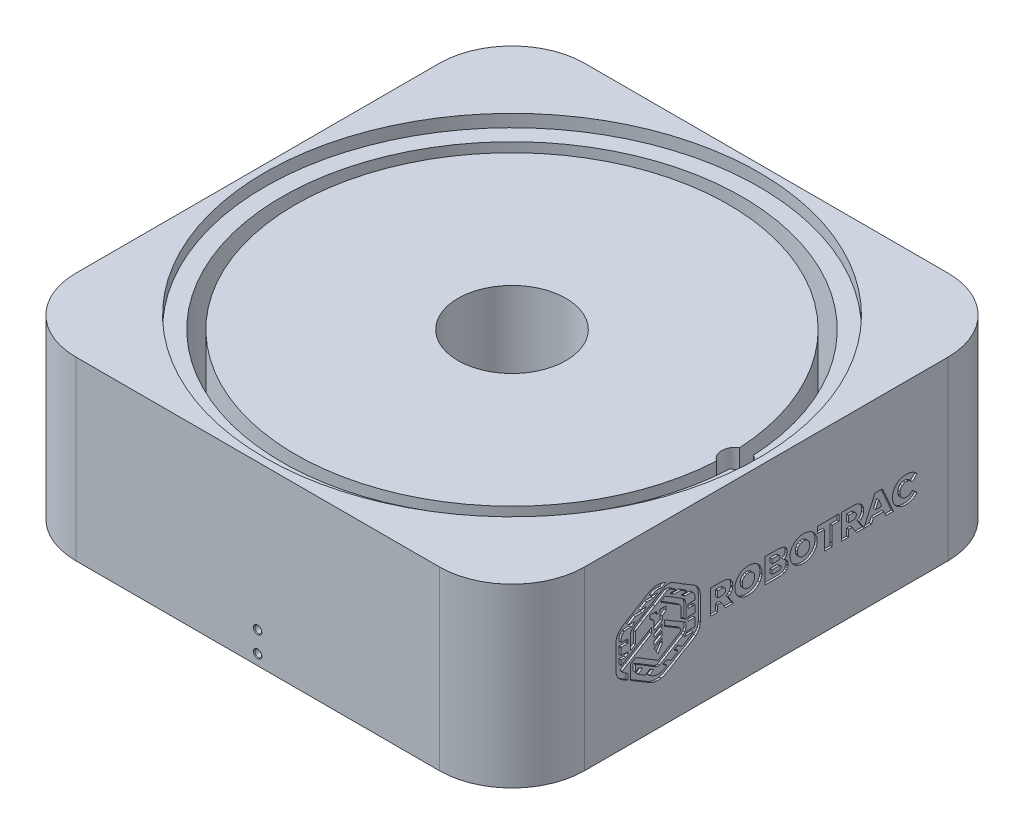
from build123d import *

# Parameters (mm, degrees)
SKETCH1_W                       = 245
SKETCH1_H                       = 245
BOSS_EXTRUDE1_DEPTH             = 85
SKETCH2_R                       = 110.75
SKETCH2_R_2                     = 104.25
CUT_EXTRUDE1_DEPTH              = 69.5
SKETCH3_R                       = 26
CUT_EXTRUDE2_DEPTH              = 193.970204954
SKETCH4_R                       = 6.5
CUT_EXTRUDE3_DEPTH              = 193.970204954
CIRPATTERN1_COUNT               = 4
SKETCH7_R                       = 119
CUT_EXTRUDE4_DEPTH              = 6
FILLET1_R                       = 35
CUT_EXTRUDE6_DEPTH              = 1
CIRPATTERN2_COUNT               = 2
SKETCH10_R                      = 3.15
CUT_EXTRUDE7_DEPTH              = 10
CUT_EXTRUDE8_DEPTH              = 10
M4X0_7_TAPPED_HOLE2_D           = 3.3
M4X0_7_TAPPED_HOLE2_DEPTH       = 10.1
M4X0_7_TAPPED_HOLE2_CSINK_D     = 4.05
M4X0_7_TAPPED_HOLE2_CSINK_ANGLE = 100
M4X0_7_TAPPED_HOLE2_TIP         = 0.991420021


with BuildPart() as part:
    # Sketch1 → Boss-Extrude1 (new body)
    with BuildSketch(Plane(origin=(0, 0, 0), x_dir=(1, 0, 0), z_dir=(0, 1, 0))):
        Rectangle(SKETCH1_W, SKETCH1_H)
    extrude(amount=BOSS_EXTRUDE1_DEPTH)

    # Sketch2 → Cut-Extrude1 (cut)
    with BuildSketch(Plane(origin=(0, 85, 0), x_dir=(1, 0, 0), z_dir=(0, 1, 0))):
        with Locations(Location((0, 0, 0), (0, 0, 270))):
            Circle(SKETCH2_R)
        with Locations(Location((0, 0, 0), (0, 0, 270))):
            Circle(SKETCH2_R_2, mode=Mode.SUBTRACT)
    extrude(amount=-CUT_EXTRUDE1_DEPTH, mode=Mode.SUBTRACT)

    # Sketch3 → Cut-Extrude2 (cut, through all)
    with BuildSketch(Plane(origin=(0, 85, 0), x_dir=(1, 0, 0), z_dir=(0, 1, 0))):
        with Locations(Location((0, 0, 0), (0, 0, 270))):
            Circle(SKETCH3_R)
    extrude(amount=-CUT_EXTRUDE2_DEPTH, mode=Mode.SUBTRACT)

    # Sketch4 → Cut-Extrude3 (cut, through all)
    with BuildSketch(Plane(origin=(0, 85, 0), x_dir=(1, 0, 0), z_dir=(0, 1, 0))):
        with Locations(Location((107.5, 0, 0), (0, 0, 270))):
            Circle(SKETCH4_R)
    extrude(amount=-CUT_EXTRUDE3_DEPTH, mode=Mode.SUBTRACT)

    # Sketch6 → M4x0.7 Tapped Hole1 (revolve, cut)
    with BuildSketch(Plane(origin=(-40, 0, 0), x_dir=(0, 0, -1), z_dir=(1, 0, 0))):
        Polygon((0, 0), (0, 12.991420021), (1.65, 12), (1.65, 0.314662362), (2.025, 0), align=None)
    m4x0_7_tapped_hole1 = revolve(axis=Axis((-40, -6.35, 0), (0, 1, 0)), mode=Mode.SUBTRACT)

    # CirPattern1: M4x0.7 Tapped Hole1 ×4 about axis
    cirpattern1_axis = Axis((0, 0, 0), (0, 1, 0))
    for i in range(1, CIRPATTERN1_COUNT):
        add(m4x0_7_tapped_hole1.rotate(cirpattern1_axis, i * 360 / CIRPATTERN1_COUNT), mode=Mode.SUBTRACT)

    # Sketch7 → Cut-Extrude4 (cut)
    with BuildSketch(Plane(origin=(0, 85, 0), x_dir=(1, 0, 0), z_dir=(0, 1, 0))):
        with Locations(Location((0, 0, 0), (0, 0, 270))):
            Circle(SKETCH7_R)
    extrude(amount=-CUT_EXTRUDE4_DEPTH, mode=Mode.SUBTRACT)

    # Fillet1
    fillet1_edges = [part.edges().sort_by_distance(p)[0] for p in [
        (122.5, 42.5, 122.5),
        (-122.5, 42.5, 122.5),
        (-122.5, 42.5, -122.5),
        (122.5, 42.5, -122.5),
    ]]
    fillet(fillet1_edges, radius=FILLET1_R)

    # Sketch9 → Cut-Extrude6 (cut)
    # profile 1 of 14: a face of its own
    with BuildSketch(Plane(origin=(122.5, 0, 0), x_dir=(0, 0, -1), z_dir=(1, 0, 0))):
        Polygon((-50.186409307, 36.587784241), (-51.106557377, 36.127710206), (-51.489952406, 35.820994183), (-53.483606557, 34.747488102), (-54.020359598, 34.364093072), (-53.943680592, 34.057377049), (-52.180063458, 31.066895822), (-50.186409307, 34.440772078), (-50.109730301, 34.670809096), (-50.186409307, 34.824167107), align=None)
    # profile 2 of 14: a face of its own
    with BuildSketch(Plane(origin=(122.5, 0, 0), x_dir=(0, 0, -1), z_dir=(1, 0, 0))):
        Polygon((-50.186409307, 39.654944474), (-50.493125331, 39.578265468), (-54.097038604, 37.431253305), (-54.17371761, 37.047858276), (-54.097038604, 35.51427816), (-50.186409307, 37.737969328), align=None)
    # profile 3 of 14: a face of its own
    with BuildSketch(Plane(origin=(122.5, 0, 0), x_dir=(0, 0, -1), z_dir=(1, 0, 0))):
        Polygon((-50.186409307, 42.722104707), (-54.097038604, 40.498413538), (-54.17371761, 40.115018509), (-54.097038604, 38.658117398), (-53.25356954, 39.041512427), (-52.486779482, 39.578265468), (-51.950026441, 39.808302485), (-50.186409307, 40.881808567), align=None)
    # profile 4 of 14: a face of its own
    with BuildSketch(Plane(origin=(122.5, 0, 0), x_dir=(0, 0, -1), z_dir=(1, 0, 0))):
        Polygon((-0.651771549, 45.865943945), (-0.728450555, 45.712585933), (-0.651771549, 45.635906928), (-0.651771549, 43.412215759), (-0.728450555, 43.335536753), (-0.651771549, 42.952141724), (-0.651771549, 39.501586462), (-0.728450555, 39.424907456), (-0.651771549, 34.057377049), (6.939450026, 34.057377049), (8.626388154, 34.440772078), (9.699894236, 35.130883131), (10.159968271, 35.744315177), (10.390005288, 36.357747224), (10.390005288, 36.741142253), (10.466684294, 36.817821259), (10.390005288, 38.044685352), (9.929931253, 39.041512427), (9.393178213, 39.578265468), (8.473030143, 40.115018509), (9.393178213, 40.805129561), (9.776573242, 41.341882602), (10.006610259, 42.031993654), (10.006610259, 43.412215759), (9.853252247, 43.872289794), (9.469857218, 44.48572184), (8.779746166, 45.099153887), (8.16631412, 45.40586991), (6.786092015, 45.789264939), (6.249338974, 45.789264939), (6.172659968, 45.865943945), align=None)
        Polygon((2.722104707, 38.581438392), (2.798783712, 38.658117398), (6.095980962, 38.658117398), (6.402696986, 38.581438392), (6.862771021, 38.198043363), (7.016129032, 37.89132734), (6.939450026, 37.201216288), (6.556054997, 36.817821259), (6.172659968, 36.664463247), (2.798783712, 36.664463247), (2.722104707, 36.741142253), align=None, mode=Mode.SUBTRACT)
        Polygon((2.722104707, 43.105499736), (2.798783712, 43.182178741), (5.635906928, 43.182178741), (6.172659968, 42.952141724), (6.479375992, 42.568746695), (6.556054997, 42.338709677), (6.479375992, 41.648598625), (6.172659968, 41.265203596), (5.789264939, 41.111845584), (2.798783712, 41.111845584), (2.722104707, 41.18852459), align=None, mode=Mode.SUBTRACT)
    # profile 5 of 14: a face of its own
    with BuildSketch(Plane(origin=(122.5, 0, 0), x_dir=(0, 0, -1), z_dir=(1, 0, 0))):
        Polygon((-26.875991539, 45.865943945), (-26.952670545, 45.789264939), (-26.952670545, 34.057377049), (-23.425436277, 34.057377049), (-23.502115283, 36.894500264), (-23.348757271, 37.277895293), (-21.815177155, 37.277895293), (-19.668164992, 34.057377049), (-15.910893707, 34.057377049), (-16.064251719, 34.440772078), (-18.364621893, 37.814648334), (-18.287942887, 37.968006346), (-17.751189847, 38.274722369), (-16.907720783, 39.118191433), (-16.447646748, 39.961660497), (-16.21760973, 40.728450555), (-16.21760973, 41.18852459), (-16.140930724, 41.265203596), (-16.21760973, 42.415388683), (-16.601004759, 43.56557377), (-17.061078794, 44.255684823), (-17.521152829, 44.715758858), (-18.211263882, 45.175832893), (-18.824695928, 45.482548916), (-19.974881015, 45.789264939), (-20.588313062, 45.789264939), (-20.664992068, 45.865943945), align=None)
        Polygon((-23.502115283, 42.875462718), (-23.348757271, 43.02882073), (-21.125066103, 43.02882073), (-20.358276044, 42.798783712), (-19.89820201, 42.338709677), (-19.668164992, 41.725277631), (-19.668164992, 41.265203596), (-19.89820201, 40.651771549), (-20.358276044, 40.191697515), (-20.971708091, 39.961660497), (-23.348757271, 39.961660497), (-23.425436277, 40.038339503), (-23.425436277, 40.805129561), (-23.502115283, 40.881808567), align=None, mode=Mode.SUBTRACT)
    # profile 6 of 14: a face of its own
    with BuildSketch(Plane(origin=(122.5, 0, 0), x_dir=(0, 0, -1), z_dir=(1, 0, 0))):
        Polygon((61.151507139, 33.827340032), (61.151507139, 33.980698043), (60.078001058, 36.281068218), (59.771285034, 37.201216288), (58.92781597, 38.888154416), (58.774457959, 39.424907456), (58.39106293, 40.115018509), (58.161025912, 40.805129561), (57.700951877, 41.648598625), (57.317556848, 42.722104707), (56.704124802, 43.872289794), (55.860655738, 45.865943945), (54.633791645, 45.865943945), (54.557112639, 45.942622951), (54.480433633, 45.865943945), (54.250396616, 45.942622951), (54.097038604, 45.865943945), (52.256742464, 45.865943945), (51.336594395, 43.642252776), (49.496298255, 39.654944474), (49.03622422, 38.428080381), (48.269434162, 36.894500264), (47.349286092, 34.59413009), (47.042570069, 34.057377049), (44.665520888, 37.661290323), (44.742199894, 37.814648334), (45.508989952, 38.274722369), (46.122421999, 38.964833421), (46.582496034, 39.808302485), (46.812533051, 40.575092544), (46.812533051, 42.262030672), (46.582496034, 43.105499736), (45.969063987, 44.179005817), (45.432310947, 44.715758858), (44.742199894, 45.175832893), (44.128767848, 45.482548916), (43.055261766, 45.789264939), (42.671866737, 45.789264939), (42.595187731, 45.865943945), (36.077472237, 45.865943945), (36.077472237, 33.904019038), (36.154151243, 33.827340032), (39.528027499, 33.827340032), (39.604706504, 33.904019038), (39.604706504, 37.047858276), (39.68138551, 37.124537282), (41.214965627, 37.124537282), (43.438656795, 33.827340032), (50.569804336, 33.827340032), (51.566631412, 36.0510312), (56.55076679, 36.0510312), (57.47091486, 33.827340032), align=None)
        Polygon((54.020359598, 42.185351666), (54.17371761, 42.10867266), (55.400581703, 39.041512427), (55.323902697, 38.734796404), (52.716816499, 38.734796404), (52.640137493, 38.81147541), align=None, mode=Mode.SUBTRACT)
        Polygon((39.604706504, 42.875462718), (39.68138551, 42.952141724), (41.828397673, 42.952141724), (42.595187731, 42.722104707), (43.208619778, 42.10867266), (43.36197779, 41.265203596), (43.131940772, 40.498413538), (42.748545743, 40.115018509), (42.288471708, 39.884981491), (41.905076679, 39.808302485), (39.68138551, 39.808302485), (39.604706504, 39.884981491), align=None, mode=Mode.SUBTRACT)
    # profile 7 of 14: a face of its own
    with BuildSketch(Plane(origin=(122.5, 0, 0), x_dir=(0, 0, -1), z_dir=(1, 0, 0))):
        Polygon((35.003966155, 45.865943945), (34.467213115, 45.865943945), (34.390534109, 45.942622951), (33.853781068, 45.942622951), (33.777102062, 45.865943945), (24.728979376, 45.865943945), (24.728979376, 42.798783712), (28.026176626, 42.798783712), (28.102855632, 42.722104707), (28.102855632, 33.904019038), (28.179534638, 33.827340032), (31.553410894, 33.827340032), (31.553410894, 35.437599154), (31.6300899, 35.51427816), (31.6300899, 42.722104707), (31.706768905, 42.798783712), (35.003966155, 42.798783712), align=None)
    # profile 8 of 14: a face of its own
    with BuildSketch(Plane(origin=(122.5, 0, 0), x_dir=(0, 0, -1), z_dir=(1, 0, 0))):
        Polygon((16.677683765, 46.019301957), (15.450819672, 45.712585933), (14.223955579, 45.099153887), (13.380486515, 44.48572184), (12.383659439, 43.335536753), (11.770227393, 42.185351666), (11.46351137, 41.035166579), (11.386832364, 39.424907456), (11.46351137, 39.348228451), (11.540190375, 38.428080381), (11.846906399, 37.507932311), (12.613696457, 36.204389212), (13.150449498, 35.590957166), (14.377313591, 34.670809096), (15.834214701, 34.057377049), (16.984399788, 33.827340032), (18.824695928, 33.827340032), (19.974881015, 34.057377049), (20.664992068, 34.287414067), (22.121893178, 35.130883131), (22.888683236, 35.820994183), (23.578794289, 36.741142253), (24.192226335, 38.121364357), (24.422263353, 39.348228451), (24.422263353, 40.651771549), (24.192226335, 41.801956637), (23.655473295, 43.02882073), (23.19539926, 43.718931782), (22.27525119, 44.639079852), (21.508461132, 45.175832893), (20.588313062, 45.635906928), (19.208090957, 46.019301957), (18.671337916, 46.019301957), (18.594658911, 46.095980962), align=None)
        Polygon((17.061078794, 43.02882073), (18.287942887, 43.105499736), (18.364621893, 43.02882073), (18.748016922, 43.02882073), (19.438127975, 42.722104707), (20.358276044, 41.878635643), (20.818350079, 40.881808567), (20.895029085, 39.424907456), (20.588313062, 38.351401375), (20.358276044, 37.968006346), (19.821523004, 37.431253305), (18.824695928, 36.894500264), (17.291115812, 36.817821259), (16.447646748, 37.124537282), (15.68085669, 37.737969328), (15.29746166, 38.274722369), (14.990745637, 39.041512427), (14.914066631, 40.26837652), (15.220782655, 41.495240613), (15.527498678, 41.955314648), (16.21760973, 42.645425701), align=None, mode=Mode.SUBTRACT)
    # profile 9 of 14: a face of its own
    with BuildSketch(Plane(origin=(122.5, 0, 0), x_dir=(0, 0, -1), z_dir=(1, 0, 0))):
        Polygon((-11.156795346, 45.712585933), (-12.153622422, 45.252511898), (-12.92041248, 44.715758858), (-14.070597567, 43.488894765), (-14.837387626, 42.031993654), (-15.144103649, 40.575092544), (-15.144103649, 39.194870439), (-14.914066631, 38.121364357), (-14.453992597, 36.97117927), (-13.763881544, 35.974352195), (-13.073770492, 35.284241142), (-11.923585405, 34.517451084), (-10.773400317, 34.057377049), (-9.546536224, 33.827340032), (-7.78291909, 33.827340032), (-6.32601798, 34.134056055), (-5.40586991, 34.517451084), (-4.255684823, 35.284241142), (-3.182178741, 36.43442623), (-2.338709677, 38.198043363), (-2.185351666, 38.81147541), (-2.185351666, 39.424907456), (-2.10867266, 39.501586462), (-2.185351666, 41.035166579), (-2.568746695, 42.338709677), (-2.875462718, 42.952141724), (-3.642252776, 44.025647805), (-4.179005817, 44.562400846), (-5.329190904, 45.329190904), (-6.019301957, 45.635906928), (-7.016129032, 45.942622951), (-7.936277102, 46.019301957), (-8.012956108, 46.095980962), (-9.316499207, 46.095980962), align=None)
        Polygon((-9.546536224, 43.02882073), (-8.242993125, 43.105499736), (-7.092808038, 42.722104707), (-6.249338974, 41.955314648), (-5.789264939, 41.111845584), (-5.635906928, 40.421734532), (-5.635906928, 39.501586462), (-6.019301957, 38.274722369), (-6.632734003, 37.507932311), (-7.169487044, 37.124537282), (-7.706240085, 36.894500264), (-9.239820201, 36.817821259), (-10.236647277, 37.201216288), (-11.080116341, 37.968006346), (-11.540190375, 38.964833421), (-11.616869381, 40.651771549), (-11.310153358, 41.571919619), (-11.080116341, 41.955314648), (-10.5433633, 42.492067689), align=None, mode=Mode.SUBTRACT)
    # profile 10 of 14: a face of its own
    with BuildSketch(Plane(origin=(122.5, 0, 0), x_dir=(0, 0, -1), z_dir=(1, 0, 0))):
        Polygon((66.058963511, 46.095980962), (64.678741407, 45.712585933), (63.835272343, 45.329190904), (62.838445267, 44.639079852), (62.225013221, 44.025647805), (61.534902168, 43.105499736), (60.921470122, 41.648598625), (60.76811211, 40.881808567), (60.76811211, 40.26837652), (60.691433104, 40.191697515), (60.76811211, 38.888154416), (60.998149127, 37.814648334), (61.458223162, 36.741142253), (62.225013221, 35.667636171), (63.375198308, 34.670809096), (64.372025383, 34.134056055), (65.215494447, 33.827340032), (66.44235854, 33.67398202), (66.519037546, 33.597303014), (68.129296668, 33.597303014), (69.356160762, 33.827340032), (70.199629825, 34.134056055), (71.273135907, 34.747488102), (72.423320994, 35.820994183), (72.5, 36.0510312), (70.352987837, 38.044685352), (69.126123744, 37.047858276), (68.359333686, 36.741142253), (66.902432575, 36.664463247), (66.058963511, 36.894500264), (65.445531465, 37.277895293), (64.755420412, 37.968006346), (64.295346378, 39.118191433), (64.295346378, 40.651771549), (64.525383395, 41.341882602), (64.908778424, 41.955314648), (65.445531465, 42.492067689), (66.289000529, 42.952141724), (66.902432575, 43.105499736), (68.205975674, 43.02882073), (69.279481756, 42.568746695), (70.352987837, 41.648598625), (72.5, 43.718931782), (72.5, 43.872289794), (71.809888948, 44.639079852), (71.196456901, 45.099153887), (70.199629825, 45.635906928), (68.589370703, 46.095980962), (67.899259651, 46.095980962), (67.822580645, 46.172659968), align=None)
    # profile 11 of 14: a face of its own
    with BuildSketch(Plane(origin=(122.5, 0, 0), x_dir=(0, 0, -1), z_dir=(1, 0, 0))):
        Polygon((-54.17371761, 41.725277631), (-54.020359598, 41.648598625), (-51.259915389, 43.335536753), (-50.569804336, 43.642252776), (-50.186409307, 43.9489688), (-50.109730301, 44.255684823), (-50.109730301, 45.482548916), (-50.186409307, 45.559227922), (-50.109730301, 45.942622951), (-48.269434162, 47.322845056), (-48.269434162, 49.163141195), (-51.259915389, 49.163141195), (-51.336594395, 49.086462189), (-51.336594395, 48.012956108), (-51.4132734, 47.936277102), (-52.870174511, 47.936277102), (-53.023532522, 48.319672131), (-53.023532522, 49.163141195), (-56.014013749, 49.163141195), (-56.014013749, 47.322845056), (-54.327075621, 46.095980962), (-54.097038604, 45.712585933), (-54.097038604, 43.795610788), (-54.17371761, 43.718931782), (-54.17371761, 41.878635643), (-54.097038604, 41.801956637), align=None)
    # profile 12 of 14: a face of its own
    with BuildSketch(Plane(origin=(122.5, 0, 0), x_dir=(0, 0, -1), z_dir=(1, 0, 0))):
        Polygon((-50.87652036, 52.230301428), (-50.953199365, 52.076943416), (-50.799841354, 51.923585405), (-42.288471708, 46.632734003), (-41.445002644, 45.942622951), (-41.214965627, 45.40586991), (-41.214965627, 40.345055526), (-38.837916446, 38.964833421), (-38.761237441, 39.271549445), (-38.761237441, 45.559227922), (-38.991274458, 46.632734003), (-39.451348493, 47.476203067), (-40.141459545, 48.16631412), (-40.524854574, 48.319672131), (-41.138286621, 48.779746166), (-42.901903755, 49.776573242), (-44.128767848, 50.620042306), (-48.806187203, 53.457165521), align=None)
    # profile 13 of 14: a face of its own
    with BuildSketch(Plane(origin=(122.5, 0, 0), x_dir=(0, 0, -1), z_dir=(1, 0, 0))):
        Polygon((-46.505817028, 57.827868852), (-47.809360127, 57.827868852), (-48.959545214, 57.444473823), (-55.63061872, 53.303807509), (-56.014013749, 53.150449498), (-56.627445796, 52.690375463), (-58.161025912, 51.846906399), (-59.004494976, 51.233474352), (-62.148334215, 49.393178213), (-63.14516129, 48.70306716), (-63.911951348, 48.319672131), (-64.755420412, 47.552882073), (-65.215494447, 46.786092015), (-65.445531465, 46.019301957), (-65.445531465, 45.635906928), (-65.522210471, 45.559227922), (-65.522210471, 39.041512427), (-65.445531465, 38.964833421), (-63.068482285, 40.421734532), (-63.068482285, 45.559227922), (-62.838445267, 46.019301957), (-62.531729244, 46.32601798), (-59.771285034, 48.089635114), (-59.387890005, 48.242993125), (-57.624272871, 49.393178213), (-54.480433633, 51.233474352), (-53.867001586, 51.693548387), (-53.483606557, 51.846906399), (-49.189582232, 54.530671602), (-47.809360127, 55.29746166), (-46.582496034, 55.29746166), (-46.352459016, 55.220782655), (-43.592014807, 53.533844527), (-43.668693813, 53.457165521), (-46.505817028, 53.457165521), (-46.429138022, 53.303807509), (-44.512162877, 52.076943416), (-41.138286621, 52.076943416), (-38.147805394, 50.159968271), (-38.2244844, 50.083289265), (-41.061607615, 50.083289265), (-40.984928609, 49.929931253), (-39.14463247, 48.70306716), (-36.000793231, 48.70306716), (-35.310682179, 48.242993125), (-35.003966155, 47.859598096), (-34.543892121, 46.939450026), (-34.313855103, 45.865943945), (-34.313855103, 44.715758858), (-34.390534109, 44.639079852), (-37.381015336, 44.639079852), (-37.687731359, 44.562400846), (-37.687731359, 42.798783712), (-37.457694342, 42.722104707), (-35.387361185, 42.722104707), (-35.157324167, 42.798783712), (-35.080645161, 42.722104707), (-34.390534109, 42.722104707), (-34.313855103, 42.645425701), (-34.313855103, 39.348228451), (-34.390534109, 39.271549445), (-37.150978318, 39.271549445), (-37.227657324, 39.194870439), (-37.687731359, 39.194870439), (-37.687731359, 37.431253305), (-34.390534109, 37.431253305), (-34.313855103, 37.354574299), (-34.313855103, 33.980698043), (-34.390534109, 33.750661026), (-34.543892121, 33.597303014), (-38.147805394, 33.597303014), (-38.761237441, 32.600475939), (-39.604706504, 31.83368588), (-35.310682179, 31.83368588), (-35.234003173, 31.757006875), (-36.000793231, 31.066895822), (-40.371496563, 28.459809625), (-40.754891592, 28.53648863), (-41.138286621, 28.843204654), (-41.675039662, 29.073241671), (-42.288471708, 29.533315706), (-42.901903755, 29.840031729), (-44.052088842, 29.149920677), (-44.512162877, 28.766525648), (-42.365150714, 27.386303543), (-45.969063987, 25.23929138), (-48.11607615, 26.542834479), (-48.499471179, 26.466155473), (-49.95637229, 25.546007403), (-48.959545214, 24.855896351), (-48.346113168, 24.549180328), (-47.886039133, 24.165785299), (-48.269434162, 23.859069276), (-50.109730301, 22.8622422), (-50.799841354, 22.632205182), (-51.719989424, 22.555526177), (-51.796668429, 22.478847171), (-52.946853517, 22.555526177), (-54.787149656, 23.168958223), (-55.323902697, 23.552353252), (-56.244050767, 24.012427287), (-56.397408778, 24.165785299), (-56.320729773, 24.31914331), (-54.940507668, 25.085933369), (-54.327075621, 25.546007403), (-56.090692755, 26.619513485), (-58.237704918, 25.315970386), (-58.467741935, 25.315970386), (-61.68826018, 27.232945531), (-61.841618191, 27.386303543), (-61.68826018, 27.539661555), (-59.924643046, 28.613167636), (-59.771285034, 28.843204654), (-61.381544157, 29.840031729), (-63.068482285, 28.766525648), (-63.14516129, 28.843204654), (-63.14516129, 32.063722898), (-62.991803279, 32.140401904), (-62.301692226, 31.680327869), (-61.534902168, 31.29693284), (-53.406927552, 26.312797462), (-52.716816499, 26.006081438), (-51.566631412, 26.006081438), (-50.87652036, 26.312797462), (-50.493125331, 26.619513485), (-48.192755156, 27.923056584), (-46.812533051, 28.843204654), (-43.745372819, 30.606821787), (-40.064780539, 32.907191962), (-39.297990481, 33.750661026), (-38.837916446, 34.824167107), (-38.761237441, 35.207562136), (-38.761237441, 37.431253305), (-38.991274458, 37.661290323), (-42.748545743, 39.961660497), (-43.131940772, 40.115018509), (-44.512162877, 41.035166579), (-45.048915918, 41.265203596), (-48.652829191, 43.488894765), (-49.03622422, 43.642252776), (-49.03622422, 40.958487573), (-41.368323638, 36.357747224), (-41.214965627, 36.127710206), (-41.214965627, 35.51427816), (-41.445002644, 34.977525119), (-41.675039662, 34.747488102), (-52.103384453, 28.383130619), (-52.256742464, 28.383130619), (-55.400581703, 30.37678477), (-57.47091486, 31.526969857), (-58.697778953, 32.370438921), (-62.991803279, 34.900846113), (-65.368852459, 33.443945003), (-65.368852459, 26.542834479), (-56.244050767, 21.098625066), (-54.71047065, 20.408514014), (-53.483606557, 20.10179799), (-53.023532522, 20.10179799), (-52.946853517, 20.025118985), (-50.723162348, 20.10179799), (-48.806187203, 20.715230037), (-43.592014807, 23.705711264), (-40.984928609, 25.315970386), (-40.064780539, 25.776044421), (-39.14463247, 26.389476467), (-38.2244844, 26.849550502), (-33.930460074, 29.533315706), (-32.856953993, 30.760179799), (-32.320200952, 31.757006875), (-31.936805923, 32.983870968), (-31.860126917, 34.057377049), (-31.783447911, 34.134056055), (-31.783447911, 45.789264939), (-31.860126917, 45.865943945), (-31.860126917, 46.479375992), (-32.013484929, 47.24616605), (-32.243521946, 47.936277102), (-32.856953993, 49.163141195), (-34.00713908, 50.466684294), (-35.387361185, 51.386832364), (-35.924114225, 51.616869381), (-36.537546272, 52.076943416), (-40.908249603, 54.684029614), (-41.905076679, 55.374140666), (-42.671866737, 55.757535695), (-44.512162877, 56.984399788), (-45.355631941, 57.444473823), align=None)
    # profile 14 of 14: a face of its own
    with BuildSketch(Plane(origin=(122.5, 0, 0), x_dir=(0, 0, -1), z_dir=(1, 0, 0))):
        Polygon((-49.95637229, 59.591485986), (-51.336594395, 59.89820201), (-52.256742464, 59.89820201), (-52.33342147, 59.974881015), (-53.790322581, 59.89820201), (-54.863828662, 59.668164992), (-55.707297726, 59.361448969), (-58.544420941, 57.751189847), (-59.387890005, 57.1377578), (-62.301692226, 55.450819672), (-64.908778424, 53.763881544), (-65.675568482, 53.380486515), (-67.285827604, 52.306980434), (-69.892913802, 50.773400317), (-71.273135907, 49.393178213), (-72.039925965, 48.012956108), (-72.5, 46.32601798), (-72.5, 33.67398202), (-72.193283977, 32.293759915), (-71.57985193, 30.990216816), (-70.966419884, 30.146747753), (-70.046271814, 29.303278689), (-67.975938657, 27.99973559), (-66.519037546, 27.232945531), (-66.519037546, 30.070068747), (-68.742728715, 31.450290851), (-69.279481756, 32.063722898), (-69.432839767, 32.523796933), (-66.902432575, 34.057377049), (-66.365679535, 34.287414067), (-59.464569011, 38.504759387), (-57.777630883, 39.424907456), (-55.247223691, 41.035166579), (-55.247223691, 43.642252776), (-55.400581703, 43.642252776), (-69.892913802, 34.900846113), (-70.046271814, 35.130883131), (-70.046271814, 37.277895293), (-69.892913802, 37.431253305), (-67.745901639, 37.431253305), (-66.595716552, 38.198043363), (-66.672395558, 39.194870439), (-67.055790587, 39.271549445), (-69.969592808, 39.271549445), (-70.046271814, 39.348228451), (-70.046271814, 42.338709677), (-69.969592808, 42.415388683), (-70.046271814, 42.645425701), (-69.969592808, 42.722104707), (-66.749074564, 42.722104707), (-66.672395558, 42.798783712), (-66.672395558, 43.56557377), (-66.595716552, 43.642252776), (-66.595716552, 44.332363829), (-66.749074564, 44.639079852), (-69.892913802, 44.639079852), (-69.969592808, 44.715758858), (-69.969592808, 45.099153887), (-70.046271814, 45.175832893), (-69.969592808, 46.249338974), (-69.662876785, 47.24616605), (-69.279481756, 47.936277102), (-68.666049709, 48.549709149), (-68.359333686, 48.70306716), (-65.138815442, 48.70306716), (-63.298519302, 49.929931253), (-63.221840296, 50.083289265), (-66.058963511, 50.083289265), (-66.135642517, 50.159968271), (-65.675568482, 50.5433633), (-63.14516129, 52.076943416), (-59.771285034, 52.076943416), (-57.700951877, 53.380486515), (-57.700951877, 53.457165521), (-60.614754098, 53.457165521), (-60.691433104, 53.533844527), (-59.541248017, 54.300634585), (-57.700951877, 55.374140666), (-54.403754627, 55.374140666), (-52.410100476, 56.601004759), (-52.486779482, 56.677683765), (-55.247223691, 56.677683765), (-55.323902697, 56.754362771), (-55.09386568, 56.984399788), (-53.636964569, 57.751189847), (-53.023532522, 57.904547858), (-51.566631412, 57.981226864), (-51.489952406, 57.904547858), (-50.416446325, 57.827868852), (-49.112903226, 58.671337916), (-48.729508197, 58.824695928), (-48.576150185, 58.97805394), align=None)
    cut_extrude6 = extrude(amount=-CUT_EXTRUDE6_DEPTH, mode=Mode.SUBTRACT)

    # CirPattern2: Cut-Extrude6 ×2 about axis
    cirpattern2_axis = Axis((0, 0, 0), (0, 1, 0))
    for i in range(1, CIRPATTERN2_COUNT):
        add(cut_extrude6.rotate(cirpattern2_axis, i * 360 / CIRPATTERN2_COUNT), mode=Mode.SUBTRACT)

    # Sketch10 → Cut-Extrude7 (cut)
    with BuildSketch(Plane.XZ):
        with Locations(Location((-95, 95, 0), (0, 0, 270))):
            Circle(SKETCH10_R)
    extrude(amount=-CUT_EXTRUDE7_DEPTH, mode=Mode.SUBTRACT)

    # Sketch11 → Cut-Extrude8 (cut)
    with BuildSketch(Plane.XZ):
        with BuildLine():
            ThreePointArc((92.984745674, -88.529972952), (90.757359313, -87.607359313), (88.529972952, -88.529972952))
            Line((88.529972952, -88.529972952), (101.470027048, -101.470027048))
            ThreePointArc((101.470027048, -101.470027048), (102.392640687, -99.242640687), (101.470027048, -97.015254326))
            Line((101.470027048, -97.015254326), (92.984745674, -88.529972952))
        make_face()
        with BuildLine():
            Line((101.470027048, -101.470027048), (88.529972952, -88.529972952))
            ThreePointArc((88.529972952, -88.529972952), (87.607359313, -90.757359313), (88.529972952, -92.984745674))
            Line((88.529972952, -92.984745674), (97.015254326, -101.470027048))
            ThreePointArc((97.015254326, -101.470027048), (99.242640687, -102.392640687), (101.470027048, -101.470027048))
        make_face()
    extrude(amount=-CUT_EXTRUDE8_DEPTH, mode=Mode.SUBTRACT)

    # M4x0.7 Tapped Hole2
    with Locations(Plane.XY.offset(122.5)):
        with Locations((0, 5), (0, 15)):
            CounterSinkHole(M4X0_7_TAPPED_HOLE2_D / 2, M4X0_7_TAPPED_HOLE2_CSINK_D / 2, depth=M4X0_7_TAPPED_HOLE2_DEPTH, counter_sink_angle=M4X0_7_TAPPED_HOLE2_CSINK_ANGLE)
            with Locations((0, 0, -(M4X0_7_TAPPED_HOLE2_DEPTH + M4X0_7_TAPPED_HOLE2_TIP / 2))):  # 118° drill point
                Cone(0, M4X0_7_TAPPED_HOLE2_D / 2, M4X0_7_TAPPED_HOLE2_TIP, mode=Mode.SUBTRACT)

    # M4x0.7 Tapped Hole3: read off the stored shape, not the designer's step
    # M4x0.7 Tapped Hole3 outline → M4x0.7 Tapped Hole3 (revolve, cut)
    with BuildSketch(Plane.XZ.offset(-15)):
        Polygon((1.65, -122.185337638), (1.65, -112.4), (0, -111.408579979), (0, -122.5), (2.025, -122.5), align=None)
    revolve(axis=Axis((0, 15, 0), (0, 0, 1)), mode=Mode.SUBTRACT)

    # M4x0.7 Tapped Hole3 2 outline → M4x0.7 Tapped Hole3 2 (revolve, cut)
    with BuildSketch(Plane.XZ.offset(-5)):
        Polygon((1.65, -122.185337638), (1.65, -112.4), (0, -111.408579979), (0, -122.5), (2.025, -122.5), align=None)
    revolve(axis=Axis((0, 5, 0), (0, 0, 1)), mode=Mode.SUBTRACT)


solid = part.part
